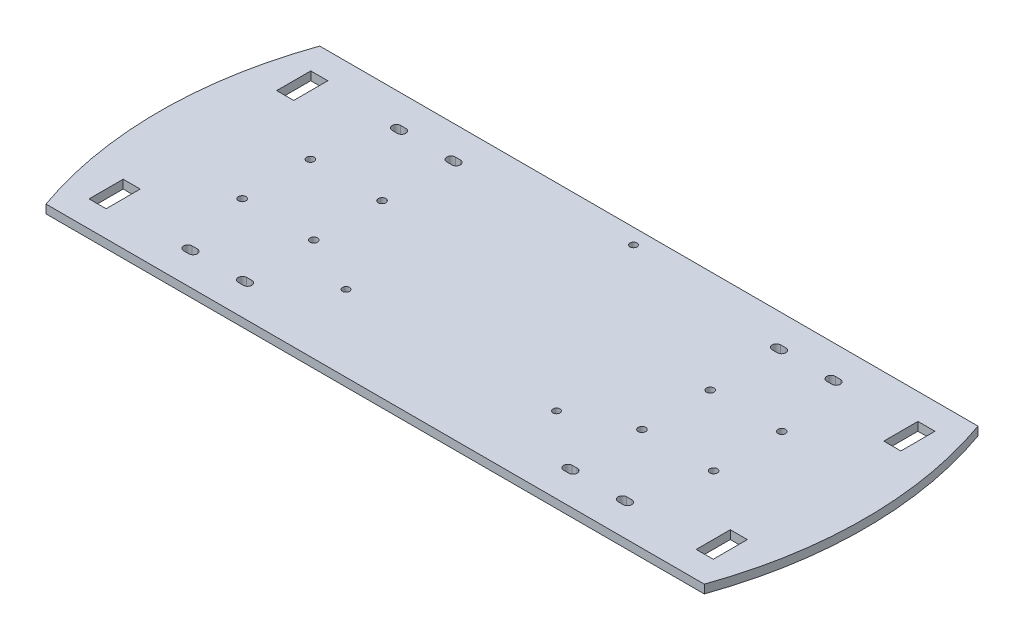
from build123d import *

# Parameters (mm, degrees)
SKETCH_1_R          = 2.05
SKETCH_1_W          = 10
SKETCH_1_H          = 20
EXTRUDE_1_DEPTH     = 5
SKETCH_4_R          = 2.2
CUT_EXTRUDE_1_DEPTH = 222.894677065


with BuildPart() as part:
    # 草圖1 → 填料-伸長1 (new body)
    with BuildSketch(Plane(origin=(0, 0, 0), x_dir=(1, 0, 0), z_dir=(0, 1, 0))):
        with BuildLine():
            Line((193, -80.25), (-193, -80.25))
            ThreePointArc((-193, -80.25), (-206.814373799, 0), (-193, 80.25))
            Line((-193, 80.25), (193, 80.25))
            ThreePointArc((193, 80.25), (206.814373799, 0), (193, -80.25))
        make_face()
        with Locations((0, 71.25)):
            Circle(SKETCH_1_R, mode=Mode.SUBTRACT)
        with Locations((61.70431002, -35.625)):
            Circle(SKETCH_1_R, mode=Mode.SUBTRACT)
        with Locations((-61.70431002, -35.625)):
            Circle(SKETCH_1_R, mode=Mode.SUBTRACT)
        with Locations((178, -55)):
            Rectangle(SKETCH_1_W, SKETCH_1_H, mode=Mode.SUBTRACT)
        with Locations((-178, -55)):
            Rectangle(SKETCH_1_W, SKETCH_1_H, mode=Mode.SUBTRACT)
        with Locations((-178, 55)):
            Rectangle(SKETCH_1_W, SKETCH_1_H, mode=Mode.SUBTRACT)
        with Locations((178, 55)):
            Rectangle(SKETCH_1_W, SKETCH_1_H, mode=Mode.SUBTRACT)
    extrude(amount=EXTRUDE_1_DEPTH)

    # 草圖4 → 除料-伸長1 (cut, through all)
    with BuildSketch(Plane(origin=(0, 5, 0), x_dir=(1, 0, 0), z_dir=(0, 1, 0))):
        with Locations((-138.2, 20)):
            Circle(SKETCH_4_R)
        with Locations((-96.2, 20)):
            Circle(SKETCH_4_R)
        with Locations((-96.2, -20)):
            Circle(SKETCH_4_R)
        with Locations((-138.2, -20)):
            Circle(SKETCH_4_R)
        with Locations((96.2, -20)):
            Circle(SKETCH_4_R)
        with Locations((138.2, -20)):
            Circle(SKETCH_4_R)
        with Locations((96.2, 20)):
            Circle(SKETCH_4_R)
        with Locations((138.2, 20)):
            Circle(SKETCH_4_R)
        with BuildLine():
            Line((-96.9, 63.65), (-93.9, 63.65))
            ThreePointArc((-93.9, 63.65), (-91.4, 61.15), (-93.9, 58.65))
            Line((-93.9, 58.65), (-96.9, 58.65))
            ThreePointArc((-96.9, 58.65), (-99.4, 61.15), (-96.9, 63.65))
        make_face()
        with BuildLine():
            Line((-128.9, 63.65), (-125.9, 63.65))
            ThreePointArc((-125.9, 63.65), (-123.4, 61.15), (-125.9, 58.65))
            Line((-125.9, 58.65), (-128.9, 58.65))
            ThreePointArc((-128.9, 58.65), (-131.4, 61.15), (-128.9, 63.65))
        make_face()
        with BuildLine():
            Line((-96.9, -63.65), (-93.9, -63.65))
            ThreePointArc((-93.9, -63.65), (-91.4, -61.15), (-93.9, -58.65))
            Line((-93.9, -58.65), (-96.9, -58.65))
            ThreePointArc((-96.9, -58.65), (-99.4, -61.15), (-96.9, -63.65))
        make_face()
        with BuildLine():
            Line((-128.9, -63.65), (-125.9, -63.65))
            ThreePointArc((-125.9, -63.65), (-123.4, -61.15), (-125.9, -58.65))
            Line((-125.9, -58.65), (-128.9, -58.65))
            ThreePointArc((-128.9, -58.65), (-131.4, -61.15), (-128.9, -63.65))
        make_face()
        with BuildLine():
            Line((96.9, -63.65), (93.9, -63.65))
            ThreePointArc((93.9, -63.65), (91.4, -61.15), (93.9, -58.65))
            Line((93.9, -58.65), (96.9, -58.65))
            ThreePointArc((96.9, -58.65), (99.4, -61.15), (96.9, -63.65))
        make_face()
        with BuildLine():
            Line((128.9, -63.65), (125.9, -63.65))
            ThreePointArc((125.9, -63.65), (123.4, -61.15), (125.9, -58.65))
            Line((125.9, -58.65), (128.9, -58.65))
            ThreePointArc((128.9, -58.65), (131.4, -61.15), (128.9, -63.65))
        make_face()
        with BuildLine():
            Line((96.9, 63.65), (93.9, 63.65))
            ThreePointArc((93.9, 63.65), (91.4, 61.15), (93.9, 58.65))
            Line((93.9, 58.65), (96.9, 58.65))
            ThreePointArc((96.9, 58.65), (99.4, 61.15), (96.9, 63.65))
        make_face()
        with BuildLine():
            Line((128.9, 63.65), (125.9, 63.65))
            ThreePointArc((125.9, 63.65), (123.4, 61.15), (125.9, 58.65))
            Line((125.9, 58.65), (128.9, 58.65))
            ThreePointArc((128.9, 58.65), (131.4, 61.15), (128.9, 63.65))
        make_face()
    extrude(amount=-CUT_EXTRUDE_1_DEPTH, mode=Mode.SUBTRACT)


solid = part.part
